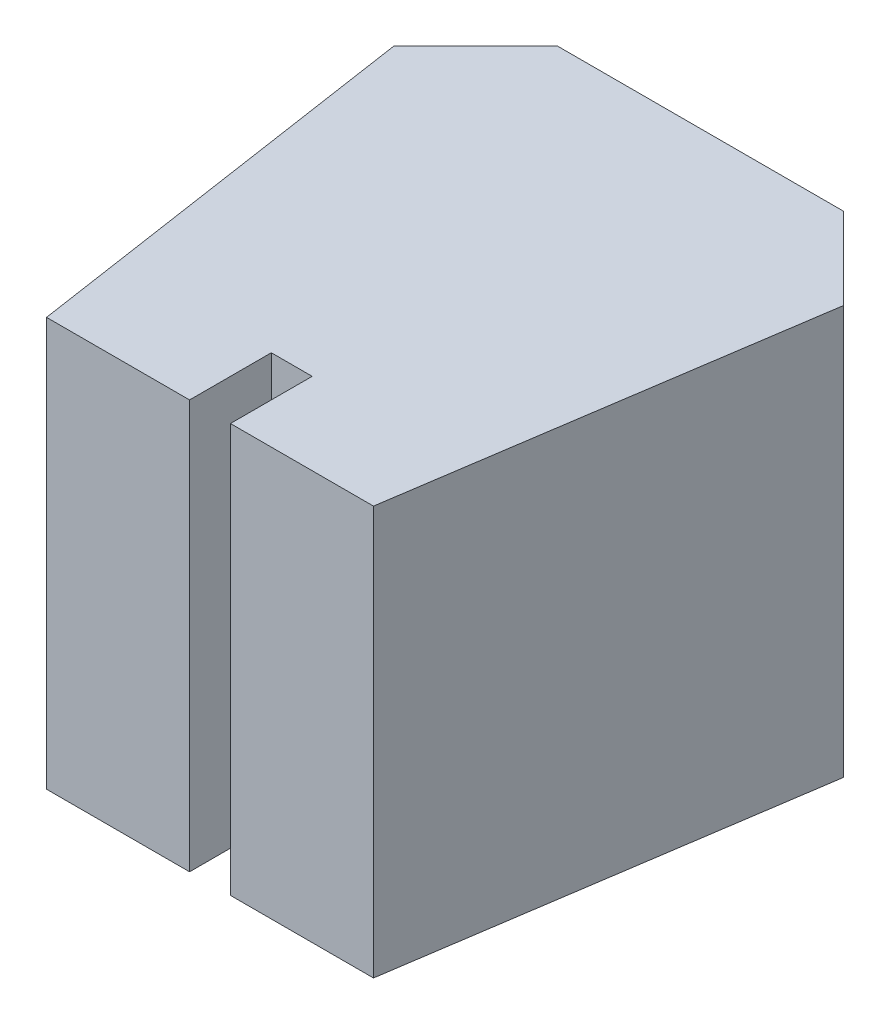
from build123d import *

# Parameters (mm, degrees)
BOSS_EXTRUDE1_DEPTH = 500


with BuildPart() as part:
    # Sketch1 → Boss-Extrude1 (new body)
    with BuildSketch(Plane(origin=(0, 0, 0), x_dir=(1, 0, 0), z_dir=(0, 1, 0))):
        Polygon((175, 300), (-175, 300), (-275, 200), (-200, -300), (-25, -300), (-25, -200), (25, -200), (25, -300), (200, -300), (275, 200), align=None)
    extrude(amount=BOSS_EXTRUDE1_DEPTH)


solid = part.part
